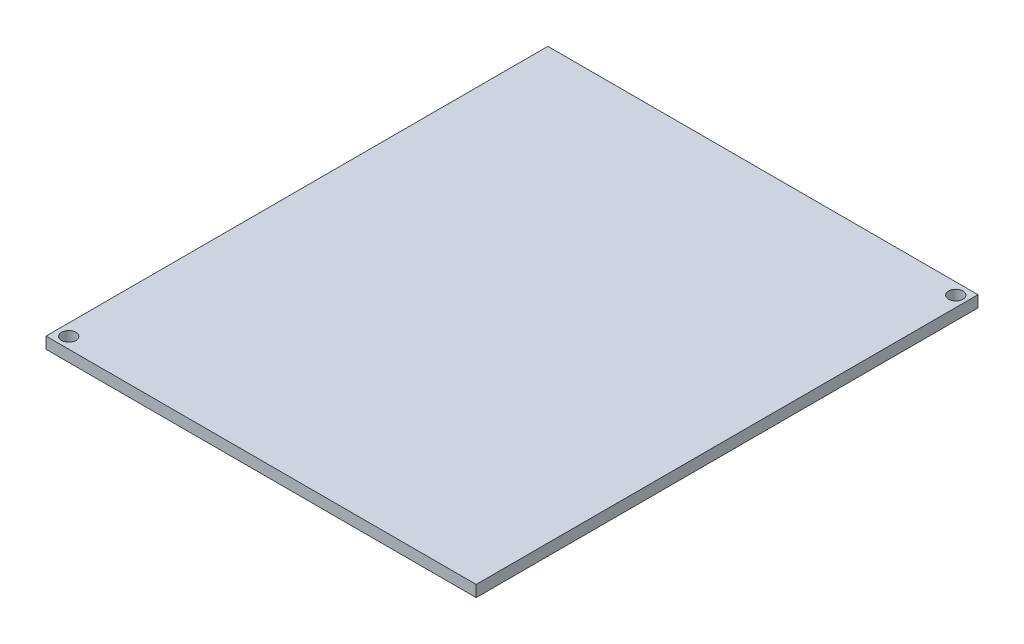
from build123d import *

# Parameters (mm, degrees)
SKETCH1_W           = 60
SKETCH1_H           = 70
SKETCH1_R           = 1
BOSS_EXTRUDE1_DEPTH = 1.6


with BuildPart() as part:
    # Sketch1 → Boss-Extrude1 (new body)
    with BuildSketch(Plane(origin=(0, 0, 0), x_dir=(1, 0, 0), z_dir=(0, 1, 0))):
        with Locations((4135.011158297, -3173.018193105)):
            Rectangle(SKETCH1_W, SKETCH1_H)
        with Locations((4163.511158297, -3139.618193105)):
            Circle(SKETCH1_R, mode=Mode.SUBTRACT)
        with Locations((4106.631158297, -3206.468193105)):
            Circle(SKETCH1_R, mode=Mode.SUBTRACT)
    extrude(amount=BOSS_EXTRUDE1_DEPTH)


solid = part.part
